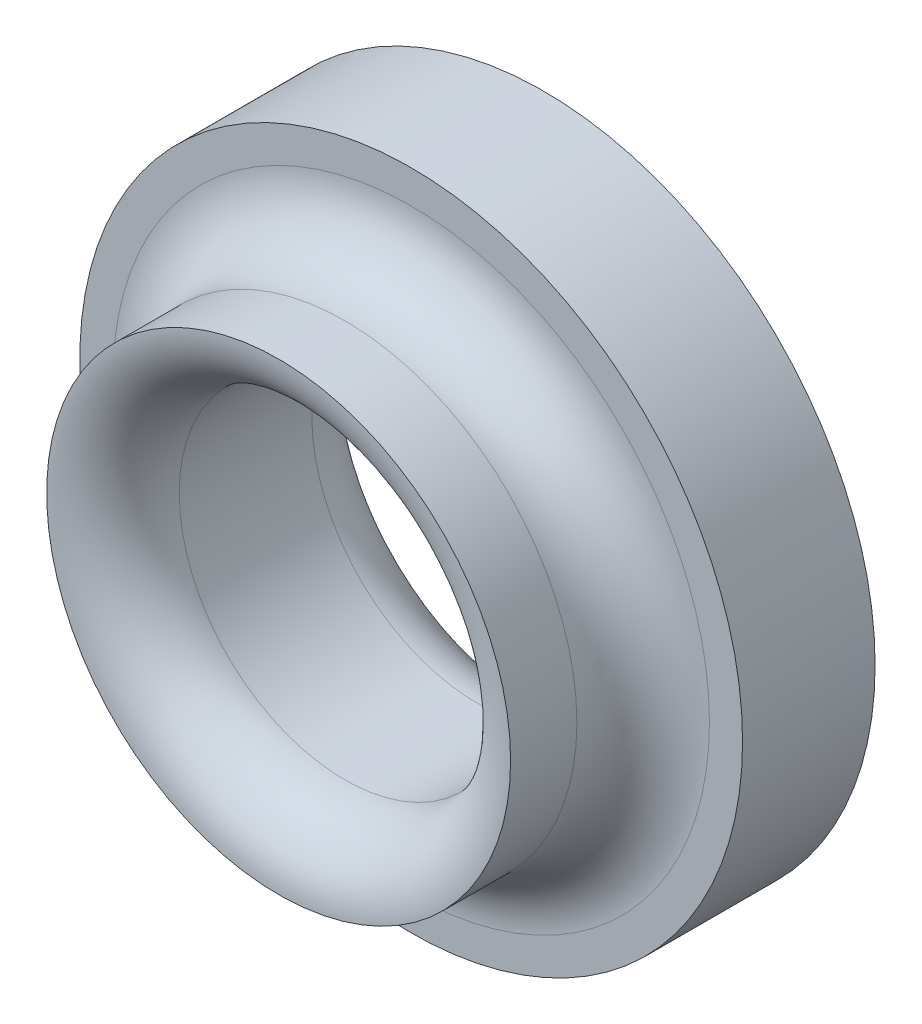
from build123d import *

# Parameters (mm, degrees)
SKETCH1_R           = 5
BOSS_EXTRUDE1_DEPTH = 2
SKETCH2_R           = 2.5
CUT_EXTRUDE1_DEPTH  = 10
SKETCH3_R           = 3.5
BOSS_EXTRUDE2_DEPTH = 2
CUT_EXTRUDE2_START  = -3
SKETCH4_R           = 2.5
CUT_EXTRUDE2_DEPTH  = 3
FILLET1_R           = 1
FILLET2_R           = 1
FILLET3_R           = 1


with BuildPart() as part:
    # Sketch1 → Boss-Extrude1 (new body)
    with BuildSketch(Plane.XY):
        Circle(SKETCH1_R)
    extrude(amount=BOSS_EXTRUDE1_DEPTH)

    # Sketch2 → Cut-Extrude1 (cut)
    with BuildSketch(Plane.XY.offset(2)):
        Circle(SKETCH2_R)
    extrude(amount=-CUT_EXTRUDE1_DEPTH, mode=Mode.SUBTRACT)

    # Sketch3 → Boss-Extrude2 (add)
    with BuildSketch(Plane.XY.offset(2)):
        Circle(SKETCH3_R)
    extrude(amount=BOSS_EXTRUDE2_DEPTH)

    # Sketch4 → Cut-Extrude2 (cut)
    with BuildSketch(Plane(origin=(0, 0, 2), x_dir=(-1, 0, 0), z_dir=(0, 0, -1)).offset(CUT_EXTRUDE2_START)):
        with Locations(Location((0, 0, 0), (0, 0, 180))):
            Circle(SKETCH4_R)
    extrude(amount=CUT_EXTRUDE2_DEPTH, mode=Mode.SUBTRACT)

    # Fillet1
    fillet1_edges = [part.edges().sort_by_distance(p)[0] for p in [
        (-2.5, 0, 0),
    ]]
    fillet(fillet1_edges, radius=FILLET1_R)

    # Fillet2
    fillet2_edges = [part.edges().sort_by_distance(p)[0] for p in [
        (-2.5, 0, 4),
    ]]
    fillet(fillet2_edges, radius=FILLET2_R - 0.0001)  # a hair under: the kernel refuses the full size

    # Fillet3
    fillet3_edges = [part.edges().sort_by_distance(p)[0] for p in [
        (-3.5, 0, 2),
    ]]
    fillet(fillet3_edges, radius=FILLET3_R)


solid = part.part
